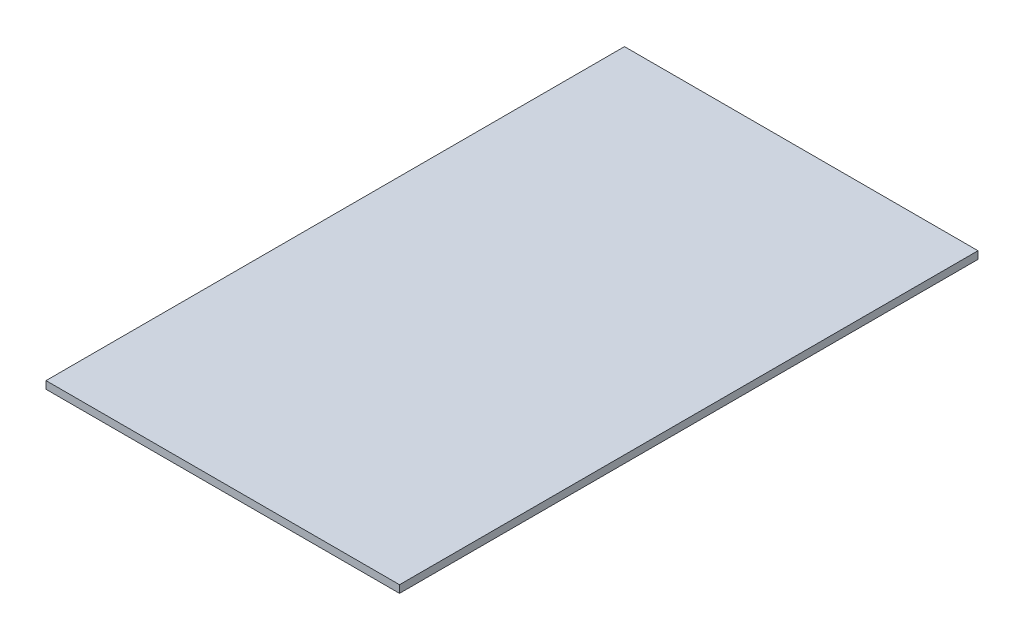
from build123d import *

# Parameters (mm, degrees)
SKETCH1_W           = 558.8
SKETCH1_H           = 914.4
BOSS_EXTRUDE1_DEPTH = 11.90625


with BuildPart() as part:
    # Sketch1 → Boss-Extrude1 (new body)
    with BuildSketch(Plane(origin=(0, 0, 0), x_dir=(1, 0, 0), z_dir=(0, 1, 0))):
        Rectangle(SKETCH1_W, SKETCH1_H)
    extrude(amount=BOSS_EXTRUDE1_DEPTH)


solid = part.part
